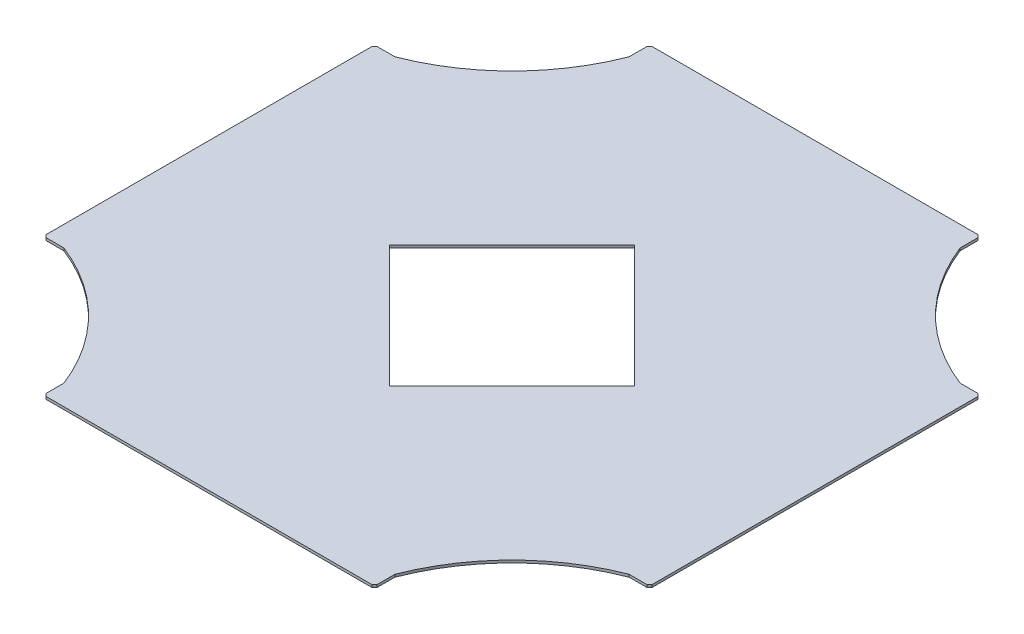
from build123d import *

# Parameters (mm, degrees)
SKETCH2_W           = 755.65
SKETCH2_H           = 755.65
BASE_FLANGE1_DEPTH  = 3.175
CUT_EXTRUDE1_DEPTH  = 535.334672162
CUT_EXTRUDE2_DEPTH  = 535.334672162
BREAK_CORNER1_START = -3.175
BREAK_CORNER1_DEPTH = 3.175


# Read off the part's stored shape, not the designer's step: Break-Corner1
# Sheet-metal steps are written as plain solids
with BuildPart() as part:
    # Sketch2 → Base-Flange1 (new body)
    with BuildSketch(Plane(origin=(0, 0, 0), x_dir=(1, 0, 0), z_dir=(0, 1, 0))):
        Rectangle(SKETCH2_W, SKETCH2_H)
    extrude(amount=-BASE_FLANGE1_DEPTH)

    # Sketch3 → Cut-Extrude1 (cut, through all)
    with BuildSketch(Plane(origin=(0, 0, 0), x_dir=(1, 0, 0), z_dir=(0, 1, 0))):
        Polygon((0, -152.664354058), (152.664354058, 0), (0, 152.664354058), (-152.664354058, 0), align=None)
    extrude(amount=-CUT_EXTRUDE1_DEPTH, mode=Mode.SUBTRACT)

    # Sketch4 → Cut-Extrude2 (cut, through all)
    with BuildSketch(Plane(origin=(0, 0, 0), x_dir=(1, 0, 0), z_dir=(0, 1, 0))):
        with BuildLine():
            Line((377.825, 206.375), (352.425, 206.375))
            ThreePointArc((352.425, 206.375), (263.993664919, 263.993664919), (206.375, 352.425))
            Line((206.375, 352.425), (206.375, 377.825))
            Line((206.375, 377.825), (377.825, 377.825))
            Line((377.825, 377.825), (377.825, 206.375))
        make_face()
        with BuildLine():
            Line((206.375, -377.825), (206.375, -352.425))
            ThreePointArc((206.375, -352.425), (263.993664919, -263.993664919), (352.425, -206.375))
            Line((352.425, -206.375), (377.825, -206.375))
            Line((377.825, -206.375), (377.825, -377.825))
            Line((377.825, -377.825), (206.375, -377.825))
        make_face()
        with BuildLine():
            Line((-377.825, -206.375), (-352.425, -206.375))
            ThreePointArc((-352.425, -206.375), (-263.993664919, -263.993664919), (-206.375, -352.425))
            Line((-206.375, -352.425), (-206.375, -377.825))
            Line((-206.375, -377.825), (-377.825, -377.825))
            Line((-377.825, -377.825), (-377.825, -206.375))
        make_face()
        with BuildLine():
            Line((-206.375, 377.825), (-206.375, 352.425))
            ThreePointArc((-206.375, 352.425), (-263.993664919, 263.993664919), (-352.425, 206.375))
            Line((-352.425, 206.375), (-377.825, 206.375))
            Line((-377.825, 206.375), (-377.825, 377.825))
            Line((-377.825, 377.825), (-206.375, 377.825))
        make_face()
    extrude(amount=-CUT_EXTRUDE2_DEPTH, mode=Mode.SUBTRACT)

    # Break-Corner1 outline → Break-Corner1 (cut)
    with BuildSketch(Plane(origin=(0, 0, 0), x_dir=(1, 0, 0), z_dir=(0, 1, 0)).offset(BREAK_CORNER1_START)):
        Polygon((-206.375, 374.65), (-203.2, 377.825), (-206.375, 377.825), align=None)
        Polygon((203.2, 377.825), (206.375, 374.65), (206.375, 377.825), align=None)
        Polygon((377.825, -206.375), (377.825, -203.2), (374.65, -206.375), align=None)
        Polygon((374.65, 206.375), (377.825, 203.2), (377.825, 206.375), align=None)
        Polygon((-374.65, -206.375), (-377.825, -203.2), (-377.825, -206.375), align=None)
        Polygon((-377.825, 203.2), (-374.65, 206.375), (-377.825, 206.375), align=None)
        Polygon((206.375, -374.65), (203.2, -377.825), (206.375, -377.825), align=None)
        Polygon((-203.2, -377.825), (-206.375, -374.65), (-206.375, -377.825), align=None)
    extrude(amount=BREAK_CORNER1_DEPTH, mode=Mode.SUBTRACT)


solid = part.part
